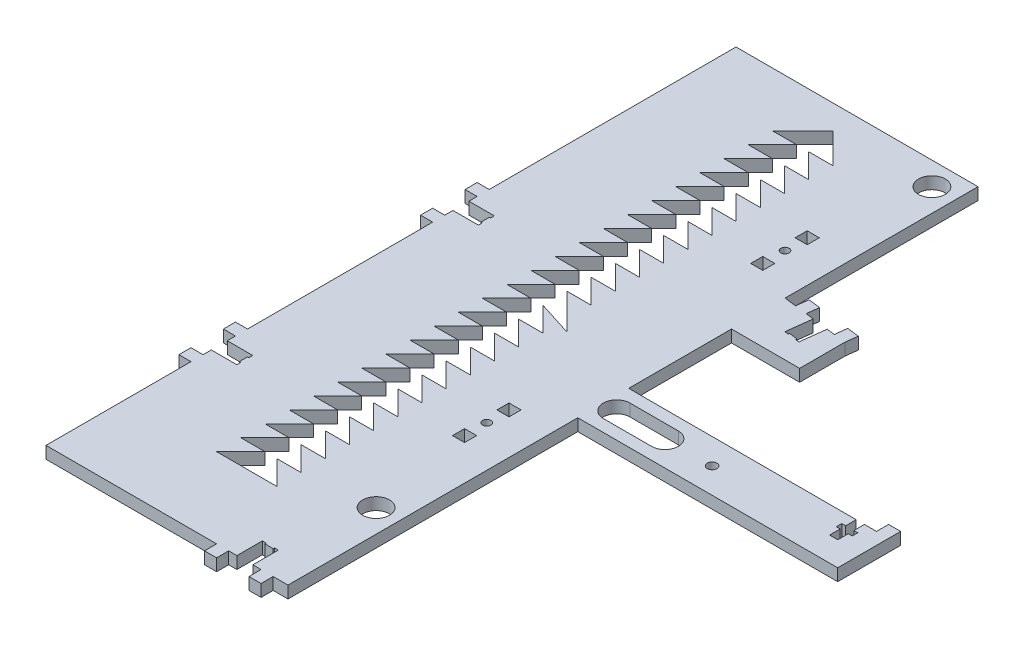
from build123d import *

# Parameters (mm, degrees)
AXLE_SUPPORT_PLATE_R   = 7.030128061
AXLE_SUPPORT_PLATE_W   = 6.35
AXLE_SUPPORT_PLATE_H   = 6.35
AXLE_SUPPORT_PLATE_R_2 = 2.159
AXLE_SUPPORT_PLATE_R_3 = 2.54
BOSS_EXTRUDE1_DEPTH    = 6.35
BOSS_EXTRUDE2_DEPTH    = 6.35


with BuildPart() as part:
    # Axle Support Plate → Boss-Extrude1 (new body)
    with BuildSketch(Plane(origin=(0, 0, 0), x_dir=(1, 0, 0), z_dir=(0, 1, 0))):
        Polygon((55.79393597, -181.31506403), (63.58606403, -181.31506403), (63.58606403, -102.239078956), (63.58606403, -29.005320151), (200.156192091, -29.005320151), (200.156192091, -2.24506403), (200.156192091, 4.10493597), (193.806192091, 4.10493597), (193.806192091, -2.24506403), (187.456192091, -2.24506403), (187.456192091, -7.780064009), (189.497192073, -7.780064009), (189.497192073, -10.680064051), (187.456192091, -10.680064051), (187.456192091, -16.21506403), (183.138192091, -16.21506403), (183.138192091, -10.680064051), (181.097192109, -10.680064051), (181.097192109, -7.780064009), (183.138192091, -7.780064009), (183.138192091, -2.24506403), (63.58606403, -2.24506403), (63.58606403, 181.31506403), (-63.58606403, 181.31506403), (-63.58606403, 51.60293597), (-69.93606403, 51.60293597), (-69.93606403, 45.25293597), (-63.58606403, 45.25293597), (-63.58606403, 40.943935952), (-50.20593597, 40.943935952), (-50.20593597, 38.90293597), (-50.88606403, 38.90293597), (-50.88606403, 34.58493597), (-50.20593597, 34.58493597), (-50.20593597, 32.543935988), (-63.58606403, 32.543935988), (-63.58606403, 28.23493597), (-69.93606403, 28.23493597), (-69.93606403, 21.88493597), (-63.58606403, 21.88493597), (-63.58606403, -75.39706403), (-69.93606403, -75.39706403), (-69.93606403, -81.74706403), (-63.58606403, -81.74706403), (-63.58606403, -86.056064048), (-50.20593597, -86.056064048), (-50.20593597, -88.09706403), (-50.88606403, -88.09706403), (-50.88606403, -92.41506403), (-50.20593597, -92.41506403), (-50.20593597, -94.456064012), (-63.58606403, -94.456064012), (-63.58606403, -98.76506403), (-69.93606403, -98.76506403), (-69.93606403, -105.11506403), (-63.58606403, -105.11506403), (-63.58606403, -181.31506403), (26.07593597, -181.31506403), (26.07593597, -187.66506403), (32.42593597, -187.66506403), (32.42593597, -181.31506403), (36.734935988, -181.31506403), (36.734935988, -167.93493597), (38.77593597, -167.93493597), (38.77593597, -168.61506403), (43.09393597, -168.61506403), (43.09393597, -167.93493597), (45.134935952, -167.93493597), (45.134935952, -181.31506403), (49.44393597, -181.31506403), (49.44393597, -187.66506403), (55.79393597, -187.66506403), align=None)
        with Locations((51.47593597, -122.89506403)):
            Circle(AXLE_SUPPORT_PLATE_R, mode=Mode.SUBTRACT)
        with Locations((41.95093597, -66.88806403)):
            Rectangle(AXLE_SUPPORT_PLATE_W, AXLE_SUPPORT_PLATE_H, mode=Mode.SUBTRACT)
        with Locations((41.95093597, -55.20406403)):
            Circle(AXLE_SUPPORT_PLATE_R_2, mode=Mode.SUBTRACT)
        with Locations((41.95093597, -43.52006403)):
            Rectangle(AXLE_SUPPORT_PLATE_W, AXLE_SUPPORT_PLATE_H, mode=Mode.SUBTRACT)
        with BuildLine():
            ThreePointArc((70.616192091, -22.655320151), (63.58606403, -15.625192091), (70.616192091, -8.59506403))
            Line((70.616192091, -8.59506403), (96.016192091, -8.59506403))
            ThreePointArc((96.016192091, -8.59506403), (103.046320151, -15.625192091), (96.016192091, -22.655320151))
            Line((96.016192091, -22.655320151), (70.616192091, -22.655320151))
        make_face(mode=Mode.SUBTRACT)
        with Locations((120.781192091, -15.625192091)):
            Circle(AXLE_SUPPORT_PLATE_R_3, mode=Mode.SUBTRACT)
        Polygon((-15.875, 152.74006403), (0, 168.61506403), (15.875, 152.74006403), (3.175, 152.74006403), (15.875, 140.04006403), (3.175, 140.04006403), (15.875, 127.34006403), (3.175, 127.34006403), (15.875, 114.64006403), (3.175, 114.64006403), (15.875, 101.94006403), (3.175, 101.94006403), (15.875, 89.24006403), (3.175, 89.24006403), (15.875, 76.54006403), (3.175, 76.54006403), (15.875, 63.84006403), (3.175, 63.84006403), (15.875, 51.14006403), (3.175, 51.14006403), (15.875, 38.44006403), (3.175, 38.44006403), (15.875, 25.74006403), (3.175, 25.74006403), (21.74875, 7.16631403), (3.175, 13.04006403), (15.875, 0.34006403), (3.175, 0.34006403), (15.875, -12.35993597), (3.175, -12.35993597), (15.875, -25.05993597), (3.175, -25.05993597), (15.875, -37.75993597), (3.175, -37.75993597), (15.875, -50.45993597), (3.175, -50.45993597), (15.875, -63.15993597), (3.175, -63.15993597), (15.875, -75.85993597), (3.175, -75.85993597), (15.875, -88.55993597), (3.175, -88.55993597), (15.875, -101.25993597), (3.175, -101.25993597), (15.875, -113.95993597), (3.175, -113.95993597), (15.875, -126.65993597), (3.175, -126.65993597), (15.875, -139.35993597), (-15.875, -139.35993597), (-3.175, -126.65993597), (-15.875, -126.65993597), (-3.175, -113.95993597), (-15.875, -113.95993597), (-3.175, -101.25993597), (-15.875, -101.25993597), (-3.175, -88.55993597), (-15.875, -88.55993597), (-3.175, -75.85993597), (-15.875, -75.85993597), (-3.175, -63.15993597), (-15.875, -63.15993597), (-3.175, -50.45993597), (-15.875, -50.45993597), (-3.175, -37.75993597), (-15.875, -37.75993597), (-3.175, -25.05993597), (-15.875, -25.05993597), (-3.175, -12.35993597), (-15.875, -12.35993597), (-3.175, 0.34006403), (-15.875, 0.34006403), (-7.092151853, 9.122912177), (-5.87375, 10.34131403), (-3.175, 13.04006403), (-15.875, 13.04006403), (-3.175, 25.74006403), (-15.875, 25.74006403), (-3.175, 38.44006403), (-15.875, 38.44006403), (-3.175, 51.14006403), (-15.875, 51.14006403), (-3.175, 63.84006403), (-15.875, 63.84006403), (-3.175, 76.54006403), (-15.875, 76.54006403), (-3.175, 89.24006403), (-15.875, 89.24006403), (-3.175, 101.94006403), (-15.875, 101.94006403), (-3.175, 114.64006403), (-15.875, 114.64006403), (-3.175, 127.34006403), (-15.875, 127.34006403), (-3.175, 140.04006403), (-15.875, 140.04006403), (-3.175, 152.74006403), align=None, mode=Mode.SUBTRACT)
        with Locations((41.95093597, 89.82993597)):
            Rectangle(AXLE_SUPPORT_PLATE_W, AXLE_SUPPORT_PLATE_H, mode=Mode.SUBTRACT)
        with Locations((41.95093597, 101.51393597)):
            Circle(AXLE_SUPPORT_PLATE_R_2, mode=Mode.SUBTRACT)
        with Locations((41.95093597, 113.19793597)):
            Rectangle(AXLE_SUPPORT_PLATE_W, AXLE_SUPPORT_PLATE_H, mode=Mode.SUBTRACT)
        with Locations((51.47593597, 169.20493597)):
            Circle(AXLE_SUPPORT_PLATE_R, mode=Mode.SUBTRACT)
    extrude(amount=BOSS_EXTRUDE1_DEPTH)

    # Sketch1 → Boss-Extrude2 (add)
    with BuildSketch(Plane(origin=(0, 6.35, 0), x_dir=(1, 0, 0), z_dir=(0, 1, 0))):
        Polygon((99.385218628, 51.769607607), (99.385218628, 75.527203072), (100.159088958, 81.829871135), (93.856420895, 82.603741465), (93.082550565, 76.301073402), (88.805669179, 76.826208405), (87.175041758, 63.54581379), (85.14925508, 63.794549118), (85.232141841, 64.469607607), (80.946327558, 64.995839432), (80.863440798, 64.320780943), (78.83765412, 64.569516271), (80.468281541, 77.849910885), (76.191400156, 78.375045888), (76.965270487, 84.677713951), (70.662602424, 85.451584282), (69.888732093, 79.148916219), (63.58606403, 79.92278655), (63.58606403, 51.769607607), align=None)
    extrude(amount=-BOSS_EXTRUDE2_DEPTH)


solid = part.part
